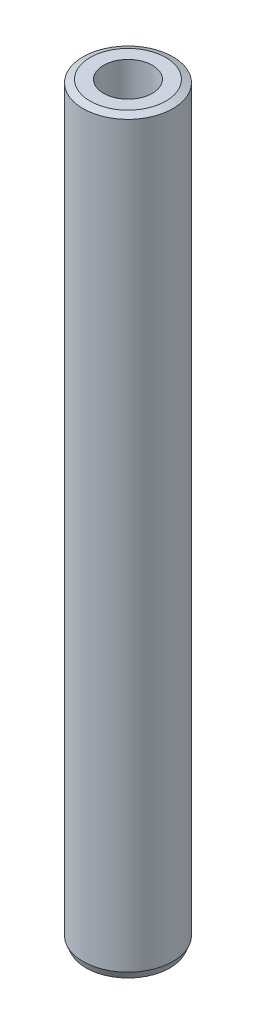
from build123d import *
from OCP.BRepFilletAPI import BRepFilletAPI_MakeChamfer

# Parameters (mm, degrees)
SKETCH1_R           = 32.5
BOSS_EXTRUDE1_DEPTH = 541.540851418
SKETCH2_R           = 17.63542575
CUT_EXTRUDE1_DEPTH  = 544.487804605
CHAMFER1_SIZE       = 2.115442153
CHAMFER1_SIZE2      = 5.127925586


with BuildPart() as part:
    # Sketch1 → Boss-Extrude1 (new body)
    with BuildSketch(Plane(origin=(0, 0, 0), x_dir=(1, 0, 0), z_dir=(0, 1, 0))):
        Circle(SKETCH1_R)
    extrude(amount=BOSS_EXTRUDE1_DEPTH)

    # Sketch2 → Cut-Extrude1 (cut, through all)
    with BuildSketch(Plane(origin=(0, 0, 0), x_dir=(1, 0, 0), z_dir=(0, 1, 0))):
        Circle(SKETCH2_R)
    extrude(amount=CUT_EXTRUDE1_DEPTH, mode=Mode.SUBTRACT)

    # Chamfer1: one chamfer whose edges measure the first distance from different faces: ONE call of the kernel's chamfer builder (chamfer() names one face for all edges)
    chamfer1_edges_1 = [part.edges().sort_by_distance(p)[0] for p in [
        (-32.5, 541.540851418, 0),
    ]]
    chamfer1_side_1 = [part.faces().sort_by_distance(p)[0] for p in [
        (-32.5, 270.770425709, 0),
    ]]
    chamfer1_edges_2 = [part.edges().sort_by_distance(p)[0] for p in [
        (-32.5, 0, 0),
    ]]
    chamfer1_side_2 = [part.faces().sort_by_distance(p)[0] for p in [
        (-31.580761184, 0, 0),
    ]]
    chamfer1 = BRepFilletAPI_MakeChamfer(part.part.solid().wrapped)
    for e in chamfer1_edges_1:
        chamfer1.Add(CHAMFER1_SIZE, CHAMFER1_SIZE2, e.wrapped, chamfer1_side_1[0].wrapped)  # the first distance lies on this face
    for e in chamfer1_edges_2:
        chamfer1.Add(CHAMFER1_SIZE, CHAMFER1_SIZE2, e.wrapped, chamfer1_side_2[0].wrapped)  # the first distance lies on this face
    add(Compound.cast(chamfer1.Shape()), mode=Mode.REPLACE)


solid = part.part
